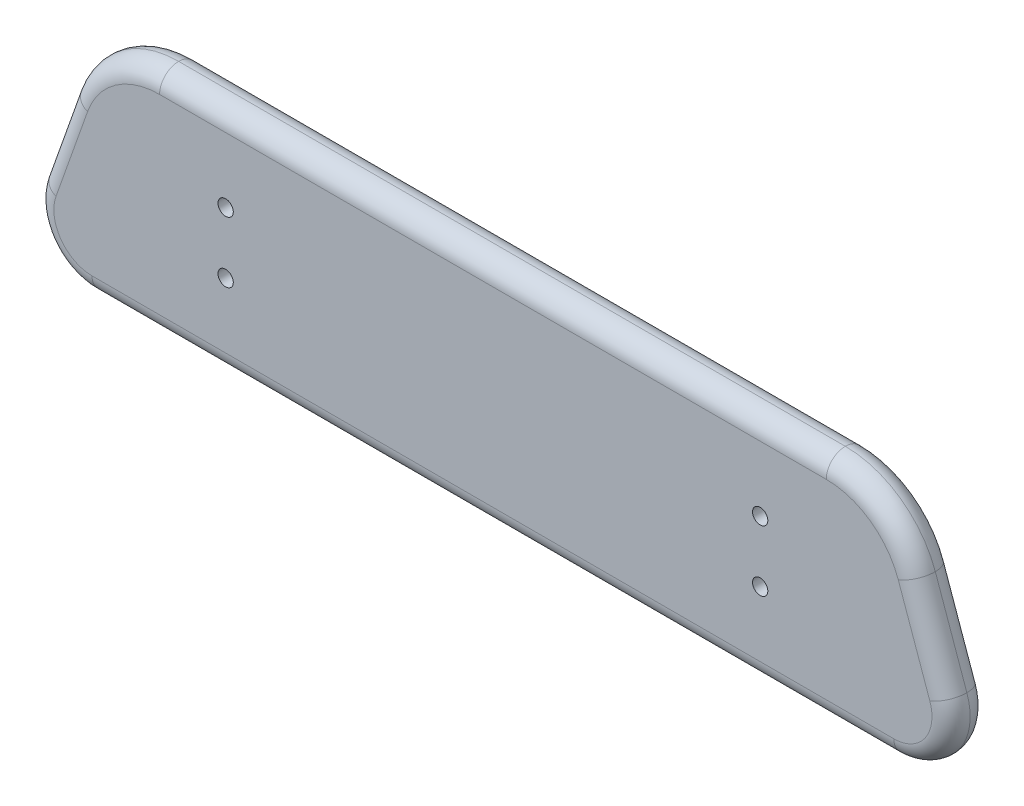
from build123d import *

# Parameters (mm, degrees)
BOSS_EXTRUDE1_DEPTH = 10
SKETCH2_R           = 2
CUT_EXTRUDE1_DEPTH  = 8
FILLET1_R           = 5


with BuildPart() as part:
    # Sketch1 → Boss-Extrude1 (new body)
    with BuildSketch(Plane.XY):
        with BuildLine():
            Line((0, 0), (-105, 0))
            ThreePointArc((-105, 0), (-117.249623327, 6.342822149), (-119.139622366, 20.007102889))
            Line((-119.139622366, 20.007102889), (-110.875178831, 43.345171481))
            ThreePointArc((-110.875178831, 43.345171481), (-101.737771304, 55.416038879), (-87.309141554, 60))
            Line((-87.309141554, 60), (87.309141554, 60))
            ThreePointArc((87.309141554, 60), (101.737771304, 55.416038879), (110.875178831, 43.345171481))
            Line((110.875178831, 43.345171481), (119.139622366, 20.007102889))
            ThreePointArc((119.139622366, 20.007102889), (117.249623327, 6.342822149), (105, 0))
            Line((105, 0), (0, 0))
        make_face()
    extrude(amount=BOSS_EXTRUDE1_DEPTH)

    # Sketch2 → Cut-Extrude1 (cut)
    with BuildSketch(Plane.XY.offset(10)):
        with Locations((-70, 22)):
            Circle(SKETCH2_R)
        with Locations((-70, 38)):
            Circle(SKETCH2_R)
        with Locations(Location((70, 22, 0), (0, 0, 180))):
            Circle(SKETCH2_R)
        with Locations(Location((70, 38, 0), (0, 0, 180))):
            Circle(SKETCH2_R)
    extrude(amount=-CUT_EXTRUDE1_DEPTH, mode=Mode.SUBTRACT)

    # Fillet1
    fillet1_edges = [part.edges().sort_by_distance(p)[0] for p in [
        (-117.249623327, 6.342822149, 0),
        (-115.007400599, 31.676137185, 0),
        (-101.737771304, 55.416038879, 0),
        (0, 60, 0),
        (101.737771304, 55.416038879, 0),
        (115.007400599, 31.676137185, 0),
        (117.249623327, 6.342822149, 0),
        (-117.249623327, 6.342822149, 10),
        (-115.007400599, 31.676137185, 10),
        (-101.737771304, 55.416038879, 10),
        (0, 60, 10),
        (101.737771304, 55.416038879, 10),
        (115.007400599, 31.676137185, 10),
        (117.249623327, 6.342822149, 10),
        (0, 0, 0),
        (0, 0, 10),
    ]]
    fillet(fillet1_edges, radius=FILLET1_R - 0.0001)  # a hair under: the kernel refuses the full size


solid = part.part
